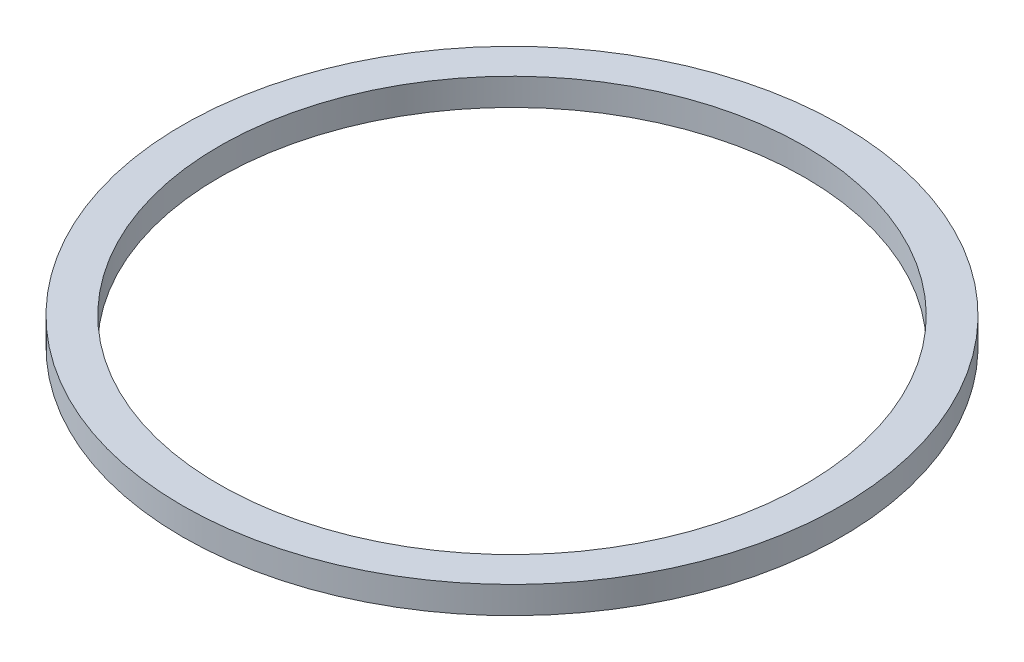
from build123d import *

# Parameters (mm, degrees)
SKETCH1_W = 7.5
SKETCH1_H = 5.5375


with BuildPart() as part:
    # Sketch1 → Revolve1 (revolve)
    with BuildSketch(Plane.XY):
        with Locations((-63.75, 15.73125)):
            Rectangle(SKETCH1_W, SKETCH1_H)
    revolve(axis=Axis((0, -200069.047495165, 0), (0, 1, 0)))


solid = part.part
